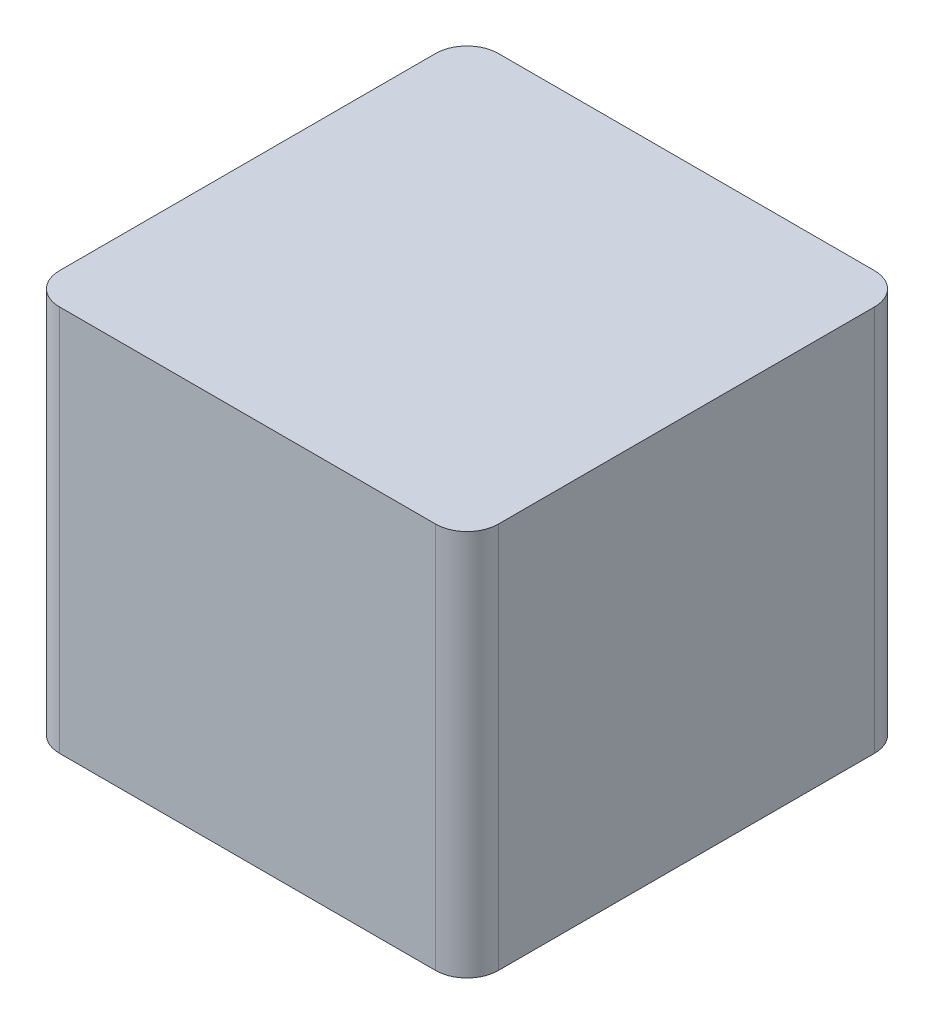
from build123d import *

# Parameters (mm, degrees)
SKETCH_1_W         = 42
SKETCH_1_H         = 37
BLOCKEXTRUDE_DEPTH = 42
FILLET_2_R         = 3


with BuildPart() as part:
    # 草图1 → BlockExtrude (new body)
    with BuildSketch(Plane.XY):
        with Locations((21, 18.5)):
            Rectangle(SKETCH_1_W, SKETCH_1_H)
    extrude(amount=BLOCKEXTRUDE_DEPTH)

    # Fillet 2
    fillet_2_edges = [part.edges().sort_by_distance(p)[0] for p in [
        (0, 18.5, 0),
        (42, 18.5, 0),
        (0, 18.5, 42),
        (42, 18.5, 42),
    ]]
    fillet(fillet_2_edges, radius=FILLET_2_R)


solid = part.part
